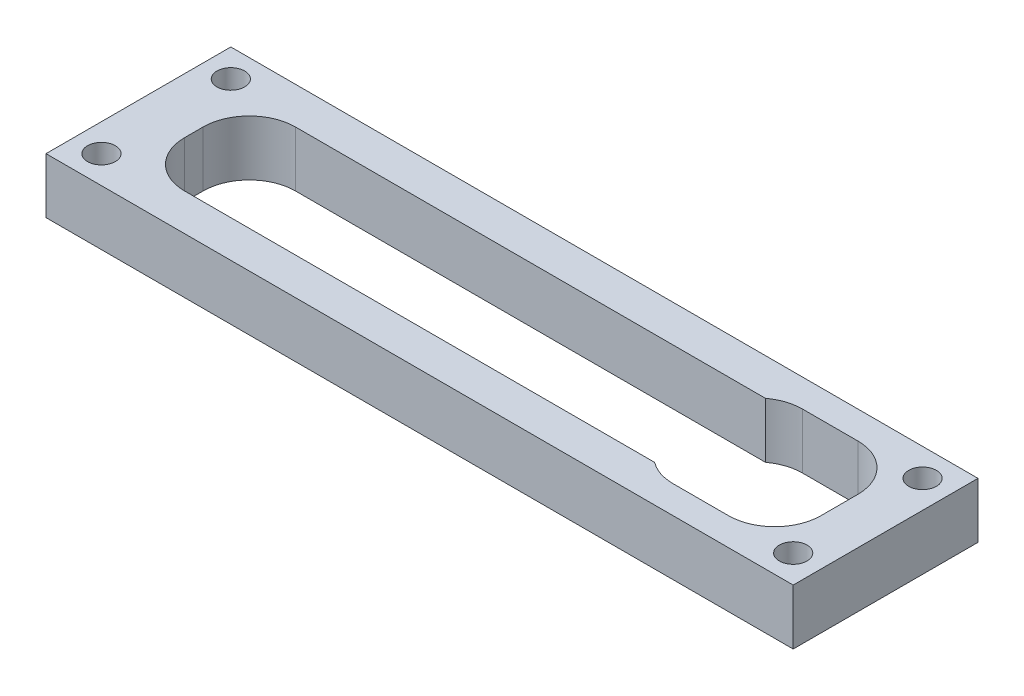
from build123d import *

# Parameters (mm, degrees)
SKETCH1_W           = 80.863890266
SKETCH1_H           = 20
SKETCH1_R           = 1.5
SKETCH1_W_2         = 68.863890266
SKETCH1_H_2         = 12
BOSS_EXTRUDE1_DEPTH = 6
CUT_EXTRUDE1_DEPTH  = 84.516278347
FILLET1_R           = 5


with BuildPart() as part:
    # Sketch1 → Boss-Extrude1 (new body)
    with BuildSketch(Plane(origin=(0, 0, 0), x_dir=(1, 0, 0), z_dir=(0, 1, 0))):
        with Locations((40.431945133, 10)):
            Rectangle(SKETCH1_W, SKETCH1_H)
        with Locations(Location((3, 17, 0), (0, 0, 270))):
            Circle(SKETCH1_R, mode=Mode.SUBTRACT)
        with Locations(Location((3, 3, 0), (0, 0, 90))):
            Circle(SKETCH1_R, mode=Mode.SUBTRACT)
        with Locations(Location((77.863890266, 3, 0), (0, 0, 270))):
            Circle(SKETCH1_R, mode=Mode.SUBTRACT)
        with Locations(Location((77.863890266, 17, 0), (0, 0, 90))):
            Circle(SKETCH1_R, mode=Mode.SUBTRACT)
        with Locations((40.431945133, 10)):
            Rectangle(SKETCH1_W_2, SKETCH1_H_2, mode=Mode.SUBTRACT)
    extrude(amount=BOSS_EXTRUDE1_DEPTH)

    # Sketch2 → Cut-Extrude1 (cut, through all)
    with BuildSketch(Plane(origin=(0, 6, 0), x_dir=(1, 0, 0), z_dir=(0, 1, 0))):
        Polygon((61.863890266, 17), (61.863890266, 16), (74.863890266, 16), (74.863890266, 4), (61.863890266, 4), (61.863890266, 3), (75.863890266, 3), (75.863890266, 17), align=None)
    extrude(amount=-CUT_EXTRUDE1_DEPTH, mode=Mode.SUBTRACT)

    # Fillet1
    # the kernel refuses this fillet: 5 mm, written as the material it adds along each edge
    with BuildSketch(Plane(origin=(75.863890266, 6, -17), x_dir=(0, 0, 1), z_dir=(0, -1, 0)), Plane(origin=(75.863890266, 6, -3), x_dir=(-1, 0, 0), z_dir=(0, -1, 0)), Plane(origin=(6, 0, -16), x_dir=(0, 0, 1), z_dir=(0, 1, 0))) as fillet1_piece_1:
        with BuildLine():
            CenterArc((FILLET1_R, FILLET1_R), FILLET1_R, 180, 90)
            Line((0, FILLET1_R), (-FILLET1_R * 0.02, FILLET1_R))
            Line((-FILLET1_R * 0.02, FILLET1_R), (-FILLET1_R * 0.02, -FILLET1_R * 0.02))
            Line((-FILLET1_R * 0.02, -FILLET1_R * 0.02), (FILLET1_R, -FILLET1_R * 0.02))
            Line((FILLET1_R, -FILLET1_R * 0.02), (FILLET1_R, 0))
        make_face()
    extrude(amount=6)
    with BuildSketch(Plane(origin=(61.863890266, 6, -17), x_dir=(1, 0, 0), z_dir=(0, -1, 0))) as fillet1_piece_2:
        with BuildLine():
            CenterArc((3, 5), FILLET1_R, 233.130102354, 36.869897646)
            Line((0, 1), (-0.06, 0.92))
            ThreePointArc((-0.06, 0.92), (-0.1, 0.5), (-0.1, 0))
            Line((-0.1, 0), (0, -0.1))
            Line((0, -0.1), (3, -0.1))
            Line((3, -0.1), (3, 0))
        make_face()
    extrude(amount=6)
    with BuildSketch(Plane(origin=(61.863890266, 6, -3), x_dir=(0, 0, -1), z_dir=(0, -1, 0))) as fillet1_piece_3:
        with BuildLine():
            CenterArc((5, 3), FILLET1_R, 180, 36.869897646)
            Line((0, 3), (-0.1, 3))
            Line((-0.1, 3), (-0.1, 0))
            Line((-0.1, 0), (0, -0.1))
            ThreePointArc((0, -0.1), (0.5, -0.1), (0.92, -0.06))
            Line((0.92, -0.06), (1, 0))
        make_face()
    extrude(amount=6)
    with BuildSketch(Plane(origin=(6, 0, -4), x_dir=(0, 0, -1), z_dir=(0, 1, 0))) as fillet1_piece_4:
        with BuildLine():
            CenterArc((FILLET1_R, -FILLET1_R), FILLET1_R, 90, 90)
            Line((0, -FILLET1_R), (-FILLET1_R * 0.02, -FILLET1_R))
            Line((-FILLET1_R * 0.02, -FILLET1_R), (-FILLET1_R * 0.02, FILLET1_R * 0.02))
            Line((-FILLET1_R * 0.02, FILLET1_R * 0.02), (FILLET1_R, FILLET1_R * 0.02))
            Line((FILLET1_R, FILLET1_R * 0.02), (FILLET1_R, 0))
        make_face()
    extrude(amount=6)


solid = part.part
